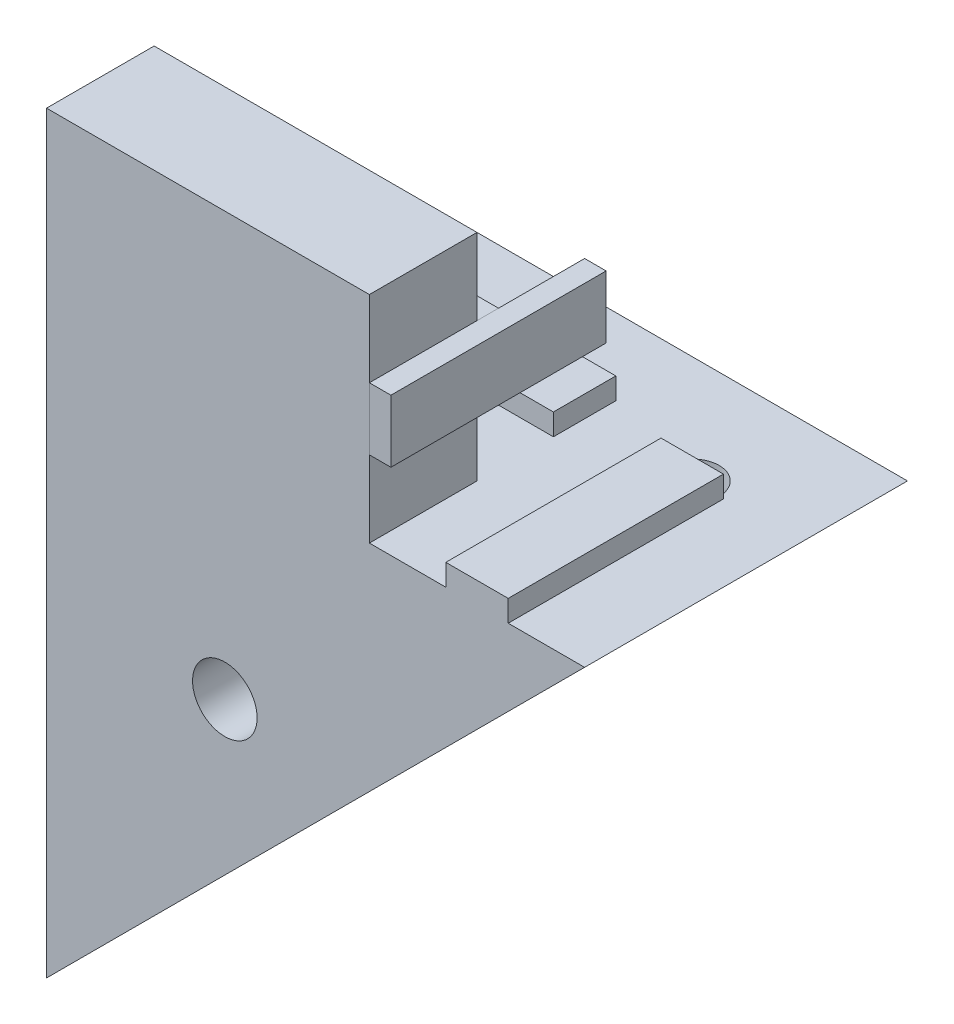
from build123d import *

# Parameters (mm, degrees)
MAIN_DEPTH          = 15
SKETCH4_W           = 15
SKETCH4_H           = 10
CUT_EXTRUDE2_DEPTH  = 10
SKETCH2_W           = 15
SKETCH2_H           = 2.9
BOSS_EXTRUDE3_DEPTH = 1
SKETCH5_W           = 2.9
SKETCH5_H           = 11.715728752
BOSS_EXTRUDE4_DEPTH = 1
SKETCH6_R           = 1.5
BOSS_EXTRUDE5_DEPTH = 5
BOSS_EXTRUDE6_DEPTH = 1
SKETCH8_W           = 2.9
SKETCH8_H           = 10
BOSS_EXTRUDE7_DEPTH = 1
SKETCH9_W           = 1
SKETCH9_H           = 2.9
BOSS_EXTRUDE8_DEPTH = 10
SKETCH11_R          = 1.25
CUT_EXTRUDE4_DEPTH  = 39.405728739
SKETCH12_R          = 1.5
CUT_EXTRUDE5_DEPTH  = 39.405728739
SKETCH13_W          = 15
SKETCH13_H          = 2.9
BOSS_EXTRUDE9_DEPTH = 1


with BuildPart() as part:
    # Sketch1 → Main (new body)
    with BuildSketch(Plane.XY):
        Polygon((0, 0), (-10, 0), (-10, 10), (-25, 10), (-25, -10.857864376), (-16.715728753, -2.573593129), (-9.644660941, -9.644660941), align=None)
    extrude(amount=MAIN_DEPTH)

    # Sketch4 → Cut-Extrude2 (cut)
    with BuildSketch(Plane(origin=(0, 0, 0), x_dir=(-1, 0, 0), z_dir=(0, 0, -1))):
        with Locations((17.5, 5)):
            Rectangle(SKETCH4_W, SKETCH4_H)
    extrude(amount=-CUT_EXTRUDE2_DEPTH, mode=Mode.SUBTRACT)

    # Sketch2 → Boss-Extrude3 (add)
    with BuildSketch(Plane(origin=(0, 0, 10), x_dir=(-1, 0, 0), z_dir=(0, 0, -1))):
        with Locations((17.5, 5)):
            Rectangle(SKETCH2_W, SKETCH2_H)
    extrude(amount=BOSS_EXTRUDE3_DEPTH)

    # Sketch5 → Boss-Extrude4 (add)
    with BuildSketch(Plane(origin=(-7.071067812, 7.071067812, 0), x_dir=(0, 0, -1), z_dir=(0.7071067811865573, -0.7071067811865378, 0))):
        with Locations((-5, -19.497474683)):
            Rectangle(SKETCH5_W, SKETCH5_H)
    extrude(amount=BOSS_EXTRUDE4_DEPTH)

    # Sketch6 → Boss-Extrude5 (add)
    with BuildSketch(Plane.XY.offset(10)):
        Polygon((-25, -10.857864376), (-16.715728753, -2.573593129), (-9.644660941, -9.644660941), (-25, -25), align=None)
        with Locations((-16.715728753, -9.644660941)):
            Circle(SKETCH6_R, mode=Mode.SUBTRACT)
    extrude(amount=BOSS_EXTRUDE5_DEPTH)

    # Sketch7 → Boss-Extrude6 (add)
    with BuildSketch(Plane(origin=(0, 0, 10), x_dir=(-1, 0, 0), z_dir=(0, 0, -1))):
        Polygon((14.205499679, -5.083822202), (25, -15.878322523), (25, -19.979541854), (12.154890014, -7.134431867), align=None)
    extrude(amount=BOSS_EXTRUDE6_DEPTH)

    # Sketch8 → Boss-Extrude7 (add)
    with BuildSketch(Plane(origin=(0, 0, 0), x_dir=(1, 0, 0), z_dir=(0, 1, 0))):
        with Locations((-5, -10)):
            Rectangle(SKETCH8_W, SKETCH8_H)
    extrude(amount=BOSS_EXTRUDE7_DEPTH)

    # Sketch11 → Cut-Extrude4 (cut, through all)
    with BuildSketch(Plane(origin=(0, 0, 0), x_dir=(1, 0, 0), z_dir=(0, 1, 0))):
        with Locations((-5, -5)):
            Circle(SKETCH11_R)
    extrude(amount=-CUT_EXTRUDE4_DEPTH, mode=Mode.SUBTRACT)

    # Sketch12 → Cut-Extrude5 (cut, through all)
    with BuildSketch(Plane.XY.offset(15)):
        with Locations((-16.715728753, -9.644660941)):
            Circle(SKETCH12_R)
    extrude(amount=-CUT_EXTRUDE5_DEPTH, mode=Mode.SUBTRACT)

    # Sketch13 → Boss-Extrude9 (add)
    with BuildSketch(Plane(origin=(0, 0, 0), x_dir=(1, 0, 0), z_dir=(0, 1, 0))):
        with Locations((-17.5, -5)):
            Rectangle(SKETCH13_W, SKETCH13_H)
    extrude(amount=BOSS_EXTRUDE9_DEPTH)


with BuildPart() as body_2:
    # Sketch9 → Boss-Extrude8 (new body)
    with BuildSketch(Plane.XY.offset(15)):
        with Locations((-9.5, 5)):
            Rectangle(SKETCH9_W, SKETCH9_H)
    extrude(amount=-BOSS_EXTRUDE8_DEPTH)


solid = Compound([part.part, body_2.part])
